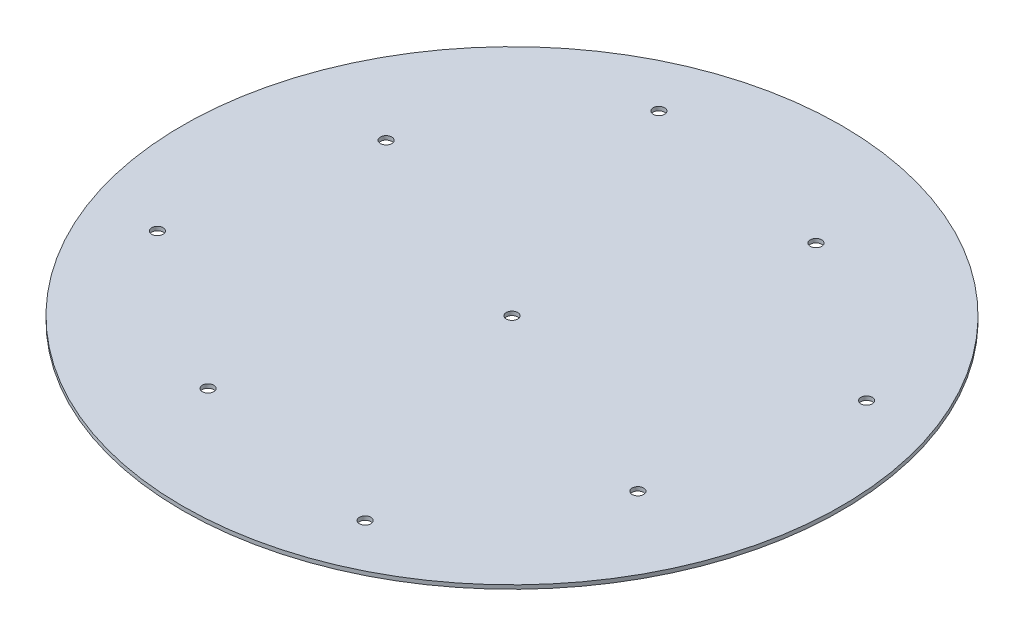
from build123d import *

# Parameters (mm, degrees)
SKETCH2_W                   = 84.99983
SKETCH2_H                   = 1
F_32_0_116_DIAMETER_HOLE1_D = 2.9464
CIRPATTERN3_COUNT           = 4
F_32_0_116_DIAMETER_HOLE2_D = 2.9464


with BuildPart() as part:
    # Sketch2 → Revolve1 (revolve)
    with BuildSketch(Plane(origin=(0, 0, 0), x_dir=(0, 0, -1), z_dir=(1, 0, 0))):
        with Locations((-42.499915, 0.5)):
            Rectangle(SKETCH2_W, SKETCH2_H)
    revolve(axis=Axis((0, -0.75, 0), (0, 1, 0)))

    # #32 (0.116) Diameter Hole1 (through all)
    with Locations(Plane(origin=(0, 1, 0), x_dir=(1, 0, 0), z_dir=(0, 1, 0))):
        with Locations((-26.787840266, 64.671567276), (264.743675233, 73.787758551), (-55.432771951, 22.961005942)):
            f_32_0_116_diameter_hole1 = Hole(F_32_0_116_DIAMETER_HOLE1_D / 2)

    # CirPattern3: #32 (0.116) Diameter Hole1 ×4 about axis
    cirpattern3_axis = Axis((0, -0.75, 0), (0, 1, 0))
    for i in range(1, CIRPATTERN3_COUNT):
        add(f_32_0_116_diameter_hole1.rotate(cirpattern3_axis, i * 360 / CIRPATTERN3_COUNT), mode=Mode.SUBTRACT)

    # #32 (0.116) Diameter Hole2 (through all)
    with Locations(Plane(origin=(0, 1, 0), x_dir=(1, 0, 0), z_dir=(0, 1, 0))):
        with Locations((0, 0)):
            Hole(F_32_0_116_DIAMETER_HOLE2_D / 2)


solid = part.part
